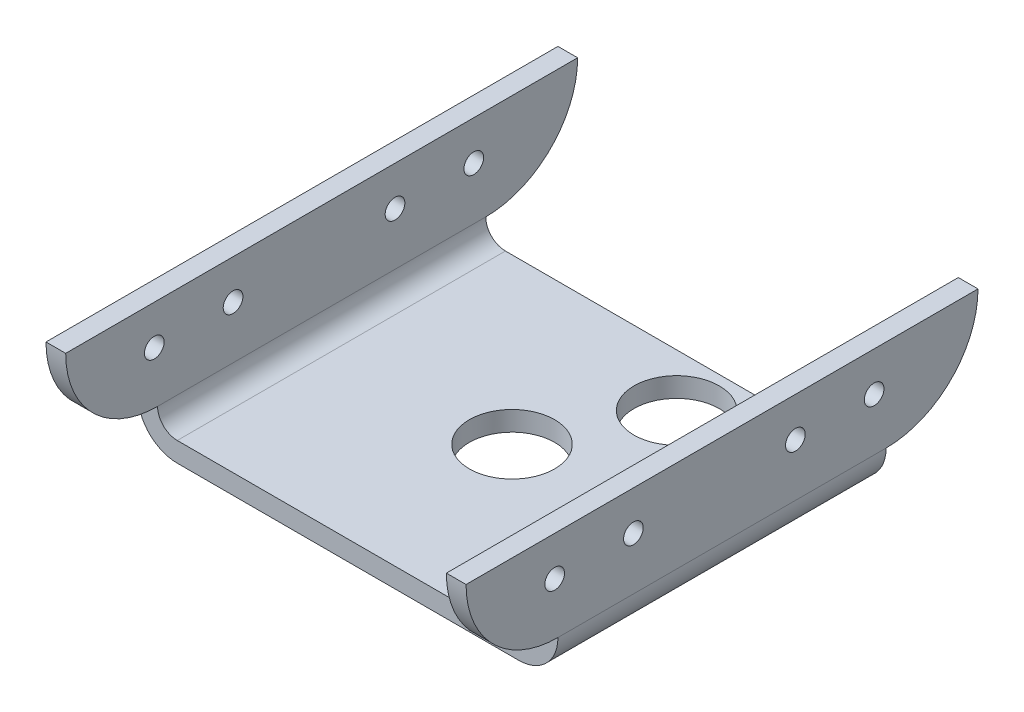
from build123d import *

# Parameters (mm, degrees)
BASE_FLANGE1_DEPTH      = 156
CUT_EXTRUDE1_DEPTH      = 206.71825393
SKETCH6_R               = 13
CUT_EXTRUDE2_DEPTH      = 10
CUT_EXTRUDE3_DEPTH      = 203.039600079
CUT_EXTRUDE3_DEPTH_BACK = 203.039600079
SKETCH7_R               = 3


# Sheet-metal steps are written as plain solids
with BuildPart() as part:
    # Sketch2 → Base-Flange1 (new body)
    with BuildSketch(Plane.XY):
        with BuildLine():
            Line((-29.957142857, 40), (-29.957142857, 12))
            ThreePointArc((-29.957142857, 12), (-26.442424231, 3.514718626), (-17.957142857, 0))
            Line((-17.957142857, 0), (86.042857143, 0))
            ThreePointArc((86.042857143, 0), (94.528138517, 3.514718626), (98.042857143, 12))
            Line((98.042857143, 12), (98.042857143, 40))
            Line((98.042857143, 40), (92.042857143, 40))
            Line((92.042857143, 40), (92.042857143, 12))
            ThreePointArc((92.042857143, 12), (90.28549783, 7.757359313), (86.042857143, 6))
            Line((86.042857143, 6), (-17.957142857, 6))
            ThreePointArc((-17.957142857, 6), (-22.199783544, 7.757359313), (-23.957142857, 12))
            Line((-23.957142857, 12), (-23.957142857, 40))
            Line((-23.957142857, 40), (-29.957142857, 40))
        make_face()
    extrude(amount=BASE_FLANGE1_DEPTH)

    # Sketch5 → Cut-Extrude1 (cut, through all)
    with BuildSketch(Plane(origin=(98.042857143, 0, 0), x_dir=(0, 0, -1), z_dir=(1, 0, 0))):
        with BuildLine():
            Line((-128, 12), (-128, 0))
            Line((-128, 0), (-156, 0))
            Line((-156, 0), (-156, 40))
            ThreePointArc((-156, 40), (-147.798989873, 20.201010127), (-128, 12))
        make_face()
        with BuildLine():
            Line((0, 0), (0, 40))
            ThreePointArc((0, 40), (-8.201010127, 20.201010127), (-28, 12))
            Line((-28, 12), (-28, 0))
            Line((-28, 0), (0, 0))
        make_face()
    extrude(amount=-CUT_EXTRUDE1_DEPTH, mode=Mode.SUBTRACT)

    # Sketch6 → Cut-Extrude2 (cut)
    with BuildSketch(Plane.XZ):
        with Locations(Location((34.042857143, 78, 0), (0, 0, 270))):
            Circle(SKETCH6_R)
        with Locations(Location((50.212608526, 44, 0), (0, 0, 270))):
            Circle(SKETCH6_R)
    extrude(amount=-CUT_EXTRUDE2_DEPTH, mode=Mode.SUBTRACT)

    # Sketch7 → Cut-Extrude3 (cut, two sides: drawn at the far end of the back side and taken through both)
    with BuildSketch(Plane.ZY.offset(-92.042857143).offset(-CUT_EXTRUDE3_DEPTH_BACK)):
        with Locations((31.647353532, 28)):
            Circle(SKETCH7_R)
        with Locations((55.647353532, 28)):
            Circle(SKETCH7_R)
        with Locations((105, 28)):
            Circle(SKETCH7_R)
        with Locations((129, 28)):
            Circle(SKETCH7_R)
    extrude(amount=CUT_EXTRUDE3_DEPTH + CUT_EXTRUDE3_DEPTH_BACK, mode=Mode.SUBTRACT)


solid = part.part
